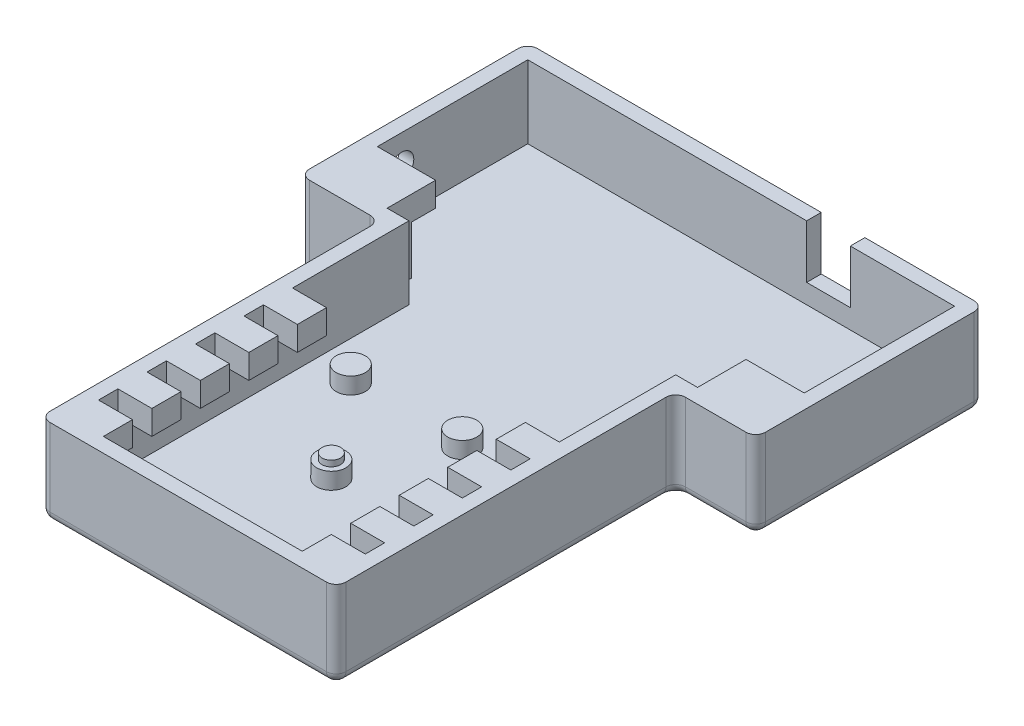
from build123d import *

# Parameters (mm, degrees)
BOSS_EXTRUDE1_DEPTH       = 15
SHELL1_T                  = 3
SKETCH3_W                 = 9
SKETCH3_H                 = 11
CUT_EXTRUDE1_DEPTH        = 3
SKETCH4_R                 = 2.5
CUT_EXTRUDE2_DEPTH        = 3
FILLET1_R                 = 2
SKETCH5_R                 = 3
BOSS_EXTRUDE2_DEPTH       = 3.4
SKETCH6_R                 = 1.9
BOSS_EXTRUDE3_DEPTH       = 1.2
SKETCH_PATTERN1_OUTLINE_R = 3
SKETCH_PATTERN1_DEPTH     = 3.4
SKETCH9_W                 = 12
SKETCH9_H                 = 5
BOSS_EXTRUDE4_DEPTH       = 15
SKETCH10_W                = 12
SKETCH10_H                = 5
BOSS_EXTRUDE5_DEPTH       = 5
SKETCH11_W                = 6
SKETCH11_H                = 5
BOSS_EXTRUDE6_DEPTH       = 7
LPATTERN1_COUNT           = 5
LPATTERN1_PITCH           = 10
MIRROR2_COPY_1_SKETCH_W   = 6
MIRROR2_COPY_1_SKETCH_H   = 5
MIRROR2_COPY_1_DEPTH      = 7
MIRROR2_COPY_2_SKETCH_W   = 6
MIRROR2_COPY_2_SKETCH_H   = 5
MIRROR2_COPY_2_DEPTH      = 7
MIRROR2_COPY_3_SKETCH_W   = 6
MIRROR2_COPY_3_SKETCH_H   = 5
MIRROR2_COPY_3_DEPTH      = 7
MIRROR2_COPY_4_SKETCH_W   = 6
MIRROR2_COPY_4_SKETCH_H   = 5
MIRROR2_COPY_4_DEPTH      = 7


# Read off the part's stored shape, not the designer's step: Sketch-Pattern1
with BuildPart() as part:
    # Sketch1 → Boss-Extrude1 (new body)
    with BuildSketch(Plane(origin=(0, 0, 0), x_dir=(1, 0, 0), z_dir=(0, 1, 0))):
        Polygon((0, 0), (88, 0), (88, -41), (71.5, -41), (71.5, -111), (16.5, -111), (16.5, -41), (0, -41), align=None)
    extrude(amount=BOSS_EXTRUDE1_DEPTH)

    # Shell1
    shell1_openings = [part.faces().sort_by_distance(p)[0] for p in [
        (44, 15, 49.150442478),
    ]]
    offset(amount=SHELL1_T, openings=shell1_openings, kind=Kind.INTERSECTION)

    # Sketch3 → Cut-Extrude1 (cut)
    with BuildSketch(Plane(origin=(0, 0, -3), x_dir=(-1, 0, 0), z_dir=(0, 0, -1))):
        with Locations((-62, 9.5)):
            Rectangle(SKETCH3_W, SKETCH3_H)
    extrude(amount=-CUT_EXTRUDE1_DEPTH, mode=Mode.SUBTRACT)

    # Sketch4 → Cut-Extrude2 (cut)
    with BuildSketch(Plane.ZY.offset(3)):
        with Locations((26, 9)):
            Circle(SKETCH4_R)
    extrude(amount=-CUT_EXTRUDE2_DEPTH, mode=Mode.SUBTRACT)

    # Fillet1
    fillet1_edges = [part.edges().sort_by_distance(p)[0] for p in [
        (44, -3, 114),
        (13.5, -3, 79),
        (5.25, -3, 44),
        (-3, -3, 20.5),
        (-3, 6, -3),
        (91, 6, -3),
        (91, 6, 44),
        (74.5, 6, 44),
        (74.5, 6, 114),
        (13.5, 6, 114),
        (13.5, 6, 44),
        (-3, 6, 44),
        (44, -3, -3),
        (91, -3, 20.5),
        (82.75, -3, 44),
        (74.5, -3, 79),
    ]]
    fillet(fillet1_edges, radius=FILLET1_R)

    # Sketch5 → Boss-Extrude2 (add)
    with BuildSketch(Plane(origin=(0, 0, 0), x_dir=(1, 0, 0), z_dir=(0, 1, 0))):
        with Locations(Location((39.5, -80, 0), (0, 0, 90))):
            Circle(SKETCH5_R)
        with Locations(Location((79.5, -20, 0), (0, 0, 90))):
            Circle(SKETCH5_R)
    extrude(amount=BOSS_EXTRUDE2_DEPTH)

    # Sketch6 → Boss-Extrude3 (add)
    with BuildSketch(Plane(origin=(0, 3.4, 0), x_dir=(1, 0, 0), z_dir=(0, 1, 0))):
        with Locations(Location((39.5, -80, 0), (0, 0, 270))):
            Circle(SKETCH6_R)
        with Locations(Location((79.5, -20, 0), (0, 0, 270))):
            Circle(SKETCH6_R)
    extrude(amount=BOSS_EXTRUDE3_DEPTH)

    # Sketch-Pattern1 outline → Sketch-Pattern1 (add)
    with BuildSketch(Plane(origin=(0, 0, 0), x_dir=(1, 0, 0), z_dir=(0, 1, 0))):
        with Locations((63.5, -103)):
            Circle(SKETCH_PATTERN1_OUTLINE_R)
        with Locations((24.5, -103)):
            Circle(SKETCH_PATTERN1_OUTLINE_R)
        with Locations((24.5, -61)):
            Circle(SKETCH_PATTERN1_OUTLINE_R)
        with Locations((47.5, -61)):
            Circle(SKETCH_PATTERN1_OUTLINE_R)
    extrude(amount=SKETCH_PATTERN1_DEPTH)

    # Sketch9 → Boss-Extrude4 (add)
    with BuildSketch(Plane(origin=(0, 0, 0), x_dir=(1, 0, 0), z_dir=(0, 1, 0))):
        with Locations((6, -38.5)):
            Rectangle(SKETCH9_W, SKETCH9_H)
        with Locations((82, -38.5)):
            Rectangle(SKETCH9_W, SKETCH9_H)
    extrude(amount=BOSS_EXTRUDE4_DEPTH)

    # Sketch10 → Boss-Extrude5 (add)
    with BuildSketch(Plane(origin=(0, 0, 36), x_dir=(-1, 0, 0), z_dir=(0, 0, -1))):
        with Locations((-6, 12.5)):
            Rectangle(SKETCH10_W, SKETCH10_H)
    boss_extrude5 = extrude(amount=BOSS_EXTRUDE5_DEPTH)

    # Mirror1: Boss-Extrude5 across plane
    add(boss_extrude5.mirror(Plane.ZY.offset(-44)))

    # Sketch11 → Boss-Extrude6 (add)
    with BuildSketch(Plane.ZY.offset(-71.5)):
        with Locations((108, 12.5)):
            Rectangle(SKETCH11_W, SKETCH11_H)
    boss_extrude6 = extrude(amount=BOSS_EXTRUDE6_DEPTH)

    # LPattern1: Boss-Extrude6 ×5
    with Locations(*[(0, 0, -i * LPATTERN1_PITCH) for i in range(1, LPATTERN1_COUNT)]):
        add(boss_extrude6)

    # Mirror2: Boss-Extrude6 across plane
    add(boss_extrude6.mirror(Plane.ZY.offset(-44)))

    # Mirror2 copy 1 sketch → Mirror2 copy 1 (add)
    with BuildSketch(Plane(origin=(16.5, 0, -10), x_dir=(0, 0, 1), z_dir=(1, 0, 0))):
        with Locations((108, -12.5)):
            Rectangle(MIRROR2_COPY_1_SKETCH_W, MIRROR2_COPY_1_SKETCH_H)
    extrude(amount=MIRROR2_COPY_1_DEPTH)

    # Mirror2 copy 2 sketch → Mirror2 copy 2 (add)
    with BuildSketch(Plane(origin=(16.5, 0, -20), x_dir=(0, 0, 1), z_dir=(1, 0, 0))):
        with Locations((108, -12.5)):
            Rectangle(MIRROR2_COPY_2_SKETCH_W, MIRROR2_COPY_2_SKETCH_H)
    extrude(amount=MIRROR2_COPY_2_DEPTH)

    # Mirror2 copy 3 sketch → Mirror2 copy 3 (add)
    with BuildSketch(Plane(origin=(16.5, 0, -30), x_dir=(0, 0, 1), z_dir=(1, 0, 0))):
        with Locations((108, -12.5)):
            Rectangle(MIRROR2_COPY_3_SKETCH_W, MIRROR2_COPY_3_SKETCH_H)
    extrude(amount=MIRROR2_COPY_3_DEPTH)

    # Mirror2 copy 4 sketch → Mirror2 copy 4 (add)
    with BuildSketch(Plane(origin=(16.5, 0, -40), x_dir=(0, 0, 1), z_dir=(1, 0, 0))):
        with Locations((108, -12.5)):
            Rectangle(MIRROR2_COPY_4_SKETCH_W, MIRROR2_COPY_4_SKETCH_H)
    extrude(amount=MIRROR2_COPY_4_DEPTH)


solid = part.part
